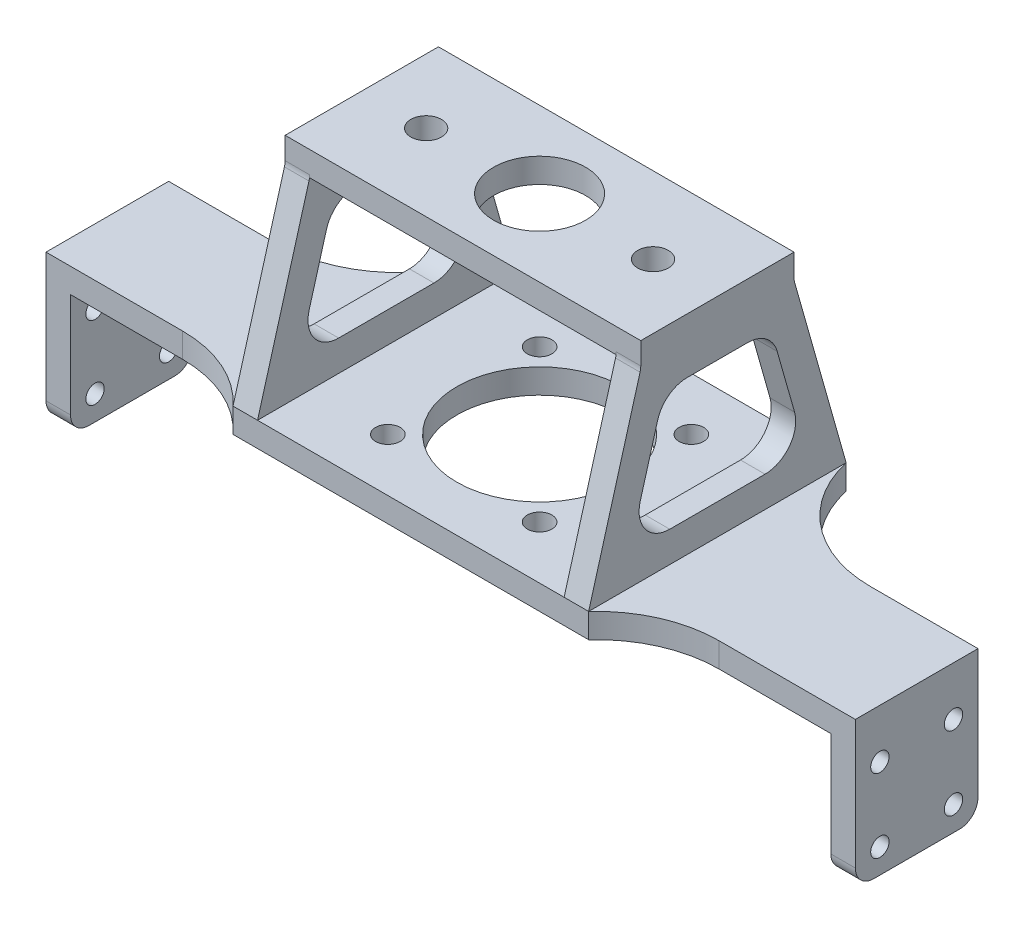
from build123d import *

# Parameters (mm, degrees)
SKETCH_1_W               = 132
SKETCH_1_H               = 42
EXTRUDE_1_DEPTH          = 4
SKETCH_2_R               = 2
SKETCH_2_R_2             = 13.5
CUT_EXTRUDE_1_DEPTH      = 4
SKETCH_3_W               = 4
SKETCH_3_H               = 42
EXTRUDE_2_DEPTH          = 30
SKETCH_4_W               = 58
SKETCH_4_H               = 42
EXTRUDE_3_DEPTH          = 4
SKETCH_5_W               = 4
SKETCH_5_H               = 42
EXTRUDE_4_DEPTH          = 20
SKETCH_6_R               = 7.5
SKETCH_6_R_2             = 2.5
CUT_EXTRUDE_2_DEPTH      = 4
CUT_EXTRUDE_3_DEPTH      = 105.450945424
FILLET_1_R               = 3
SKETCH_8_W               = 37
SKETCH_8_H               = 6.5
CUT_EXTRUDE_4_DEPTH      = 24
FILLET_2_R               = 20
CUT_EXTRUDE_6_DEPTH      = 105.450945424
CUT_EXTRUDE_7_DEPTH      = 139.956827828
CUT_EXTRUDE_7_DEPTH_BACK = 139.956827828
SKETCH_12_R              = 1.5
FILLET_5_R               = 3
FILLET_6_R               = 5


with BuildPart() as part:
    # 草图1 → 凸台-拉伸1 (new body)
    with BuildSketch(Plane(origin=(0, 0, 0), x_dir=(1, 0, 0), z_dir=(0, 1, 0))):
        Rectangle(SKETCH_1_W, SKETCH_1_H)
    extrude(amount=EXTRUDE_1_DEPTH)

    # 草图2 → 切除-拉伸1 (cut)
    with BuildSketch(Plane(origin=(0, 4, 0), x_dir=(1, 0, 0), z_dir=(0, 1, 0))):
        with Locations(Location((12.374368671, 12.374368671, 0), (0, 0, 270))):
            Circle(SKETCH_2_R)
        with Locations(Location((12.374368671, -12.374368671, 0), (0, 0, 270))):
            Circle(SKETCH_2_R)
        with Locations(Location((-12.374368671, -12.374368671, 0), (0, 0, 270))):
            Circle(SKETCH_2_R)
        with Locations(Location((-12.374368671, 12.374368671, 0), (0, 0, 270))):
            Circle(SKETCH_2_R)
        with Locations(Location((0, 0, 0), (0, 0, 270))):
            Circle(SKETCH_2_R_2)
    extrude(amount=-CUT_EXTRUDE_1_DEPTH, mode=Mode.SUBTRACT)

    # 草图3 → 凸台-拉伸2 (add)
    with BuildSketch(Plane(origin=(0, 4, 0), x_dir=(1, 0, 0), z_dir=(0, 1, 0))):
        with Locations((27, 0)):
            Rectangle(SKETCH_3_W, SKETCH_3_H)
        with Locations((-27, 0)):
            Rectangle(SKETCH_3_W, SKETCH_3_H)
    extrude(amount=EXTRUDE_2_DEPTH)

    # 草图4 → 凸台-拉伸3 (add)
    with BuildSketch(Plane(origin=(0, 34, 0), x_dir=(1, 0, 0), z_dir=(0, 1, 0))):
        Rectangle(SKETCH_4_W, SKETCH_4_H)
    extrude(amount=EXTRUDE_3_DEPTH)

    # 草图5 → 凸台-拉伸4 (add)
    with BuildSketch(Plane.XZ):
        with Locations((64, 0)):
            Rectangle(SKETCH_5_W, SKETCH_5_H)
        with Locations((-64, 0)):
            Rectangle(SKETCH_5_W, SKETCH_5_H)
    extrude(amount=EXTRUDE_4_DEPTH)

    # 草图6 → 切除-拉伸2 (cut)
    with BuildSketch(Plane(origin=(0, 38, 0), x_dir=(1, 0, 0), z_dir=(0, 1, 0))):
        with Locations(Location((0, 0, 0), (0, 0, 270))):
            Circle(SKETCH_6_R)
        with Locations(Location((-18.5, 0, 0), (0, 0, 270))):
            Circle(SKETCH_6_R_2)
        with Locations(Location((18.5, 0, 0), (0, 0, 90))):
            Circle(SKETCH_6_R_2)
    extrude(amount=-CUT_EXTRUDE_2_DEPTH, mode=Mode.SUBTRACT)

    # 草图7 → 切除-拉伸3 (cut, through all)
    with BuildSketch(Plane.ZY.offset(29)):
        Polygon((-21, 4), (-12.5, 34), (-12.5, 38), (-21, 38), align=None)
        Polygon((21, 38), (12.5, 38), (12.5, 34), (21, 4), align=None)
    extrude(amount=-CUT_EXTRUDE_3_DEPTH, mode=Mode.SUBTRACT)

    # 圆角1
    fillet_1_edges = [part.edges().sort_by_distance(p)[0] for p in [
        (-27, 34, -12.5),
        (27, 34, -12.5),
        (27, 34, 12.5),
        (-27, 34, 12.5),
    ]]
    fillet(fillet_1_edges, radius=FILLET_1_R)

    # 草图8 → 切除-拉伸4 (cut)
    with BuildSketch(Plane(origin=(0, 4, 0), x_dir=(1, 0, 0), z_dir=(0, 1, 0))):
        Polygon((-66, 5.5), (-66, 21), (-29, 21), (-29, 5.5), (-62, 5.5), align=None)
        with Locations((47.5, -17.75)):
            Rectangle(SKETCH_8_W, SKETCH_8_H)
        Polygon((66, 5.5), (66, 21), (29, 21), (29, 5.5), (62, 5.5), align=None)
        with Locations((-47.5, -17.75)):
            Rectangle(SKETCH_8_W, SKETCH_8_H)
    extrude(amount=-CUT_EXTRUDE_4_DEPTH, mode=Mode.SUBTRACT)

    # 圆角2
    # the kernel refuses this fillet: 20 mm, written as the material it adds along each edge
    with BuildSketch(Plane(origin=(29, 4, 14.5), x_dir=(0, 0, 1), z_dir=(0, -1, 0))) as fillet_2_piece_1:
        with BuildLine():
            CenterArc((20, -14.756354563), FILLET_2_R, 132.454150204, 47.545849796)
            Line((0, -14.756354563), (0, 0))
            Line((0, 0), (6.5, 0))
        make_face()
    extrude(amount=4)
    with BuildSketch(Plane(origin=(29, 4, -5.5), x_dir=(0, 0, -1), z_dir=(0, -1, 0))) as fillet_2_piece_2:
        with BuildLine():
            CenterArc((20, 19.48717527), FILLET_2_R, 180, 76.997121837)
            Line((0, 19.48717527), (0, 0))
            Line((0, 0), (15.5, 0))
        make_face()
    extrude(amount=4)
    with BuildSketch(Plane(origin=(-29, 4, -5.5), x_dir=(0, 0, -1), z_dir=(0, -1, 0))) as fillet_2_piece_3:
        with BuildLine():
            CenterArc((20, -19.48717527), FILLET_2_R, 103.002878163, 76.997121837)
            Line((0, -19.48717527), (0, 0))
            Line((0, 0), (15.5, 0))
        make_face()
    extrude(amount=4)
    with BuildSketch(Plane(origin=(-29, 4, 14.5), x_dir=(0, 0, 1), z_dir=(0, -1, 0))) as fillet_2_piece_4:
        with BuildLine():
            CenterArc((20, 14.756354563), FILLET_2_R, 180, 47.545849796)
            Line((0, 14.756354563), (0, 0))
            Line((0, 0), (6.5, 0))
        make_face()
    extrude(amount=4)

    # 草图11 → 切除-拉伸6 (cut, through all)
    with BuildSketch(Plane.ZY.offset(29)):
        Polygon((8.719846057, 29), (-8.719846057, 29), (-14.386512724, 9), (14.386512724, 9), align=None)
    extrude(amount=-CUT_EXTRUDE_6_DEPTH, mode=Mode.SUBTRACT)

    # 草图12 → 切除-拉伸7 (cut, two sides: drawn at the far end of the back side and taken through both)
    with BuildSketch(Plane.ZY.offset(66).offset(-CUT_EXTRUDE_7_DEPTH_BACK)):
        with Locations((-1.5, -4)):
            Circle(SKETCH_12_R)
        with Locations(Location((10.5, -4, 0), (0, 0, 180))):
            Circle(SKETCH_12_R)
        with Locations((10.5, -16)):
            Circle(SKETCH_12_R)
        with Locations(Location((-1.5, -16, 0), (0, 0, 180))):
            Circle(SKETCH_12_R)
    extrude(amount=CUT_EXTRUDE_7_DEPTH + CUT_EXTRUDE_7_DEPTH_BACK, mode=Mode.SUBTRACT)

    # 圆角5
    fillet_5_edges = [part.edges().sort_by_distance(p)[0] for p in [
        (64, -20, -5.5),
        (-64, -20, 14.5),
        (64, -20, 14.5),
        (-64, -20, -5.5),
    ]]
    fillet(fillet_5_edges, radius=FILLET_5_R)

    # 圆角6
    fillet_6_edges = [part.edges().sort_by_distance(p)[0] for p in [
        (-27, 29, 8.719846057),
        (27, 29, 8.719846057),
        (-27, 9, 14.386512724),
        (27, 9, 14.386512724),
        (-27, 9, -14.386512724),
        (27, 9, -14.386512724),
        (-27, 29, -8.719846057),
        (27, 29, -8.719846057),
    ]]
    fillet(fillet_6_edges, radius=FILLET_6_R)


solid = part.part
